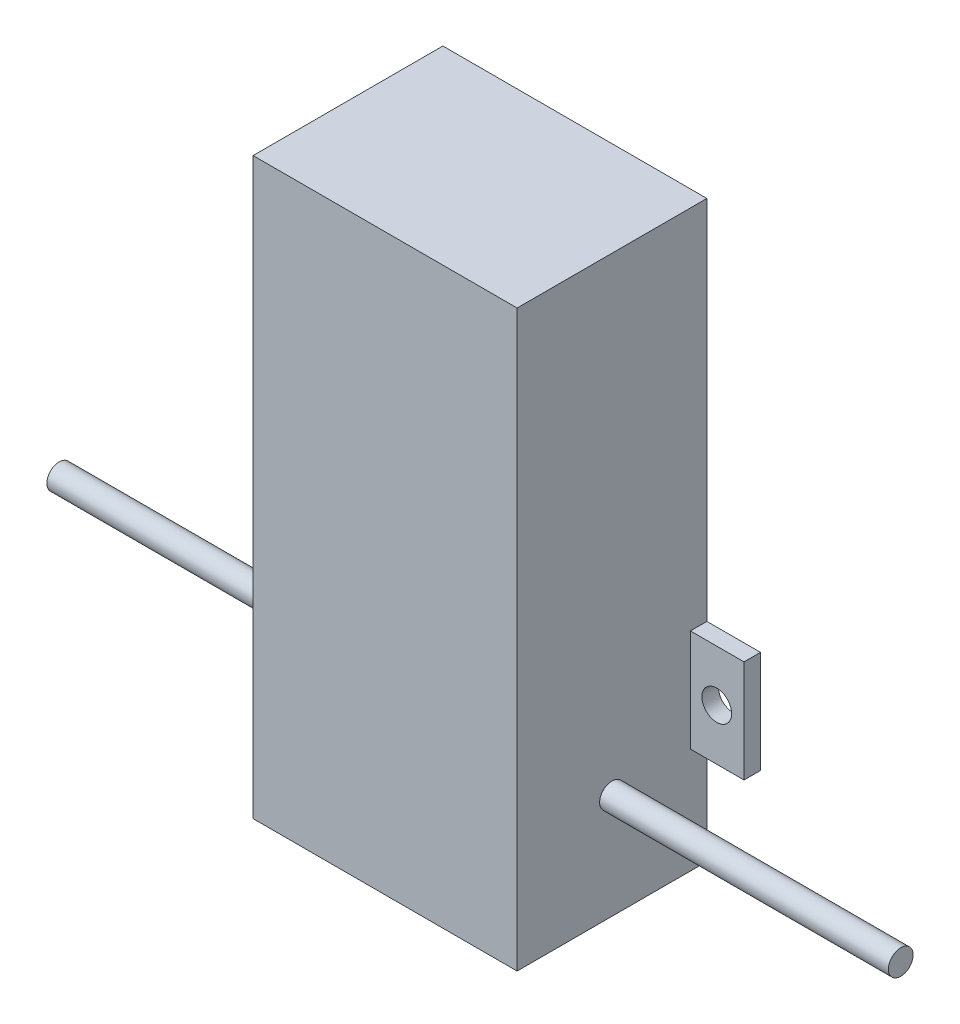
from build123d import *

# Parameters (mm, degrees)
SKETCH_1_W            = 32
SKETCH_1_H            = 69.6
EXTRUDE_1_DEPTH       = 23
SKETCH_2_R            = 1.5
EXTRUDE_2_DEPTH       = 35
SKETCH_3_W            = 2
SKETCH_3_H            = 3.6
EXTRUDE_3_DEPTH       = 4.5
SKETCH_5_W            = 16
SKETCH_5_H            = 23
CUT_EXTRUDE_1_DEPTH   = 71.5
SKETCH_6_W            = 4.5
SKETCH_6_H            = 3.6
CUT_EXTRUDE_2_DEPTH   = 1
SKETCH_7_W            = 2
SKETCH_7_H            = 4.4
EXTRUDE_4_DEPTH       = 6.5
SKETCH_9_W            = 1
SKETCH_9_H            = 1.8
CUT_EXTRUDE_3_DEPTH   = 4.5
MIRROR_4_OUTLINE_W    = 4.5
MIRROR_4_OUTLINE_H    = 1.8
MIRROR_4_DEPTH        = 1
MIRROR_4_2_OUTLINE_W  = 6.5
MIRROR_4_2_OUTLINE_H  = 4.4
MIRROR_4_2_DEPTH      = 2
SKETCH_10_W           = 1.5
SKETCH_10_H           = 2
EXTRUDE_5_DEPTH       = 4.5
MIRROR_START          = 34.279062003
MIRROR_25_OUTLINE_W   = 69.6
MIRROR_25_OUTLINE_H   = 23
MIRROR_25_DEPTH       = 16
MIRROR_START_2        = -0.720937997
MIRROR_25_2_OUTLINE_R = 1.5
MIRROR_25_2_DEPTH     = 35
MIRROR_START_3        = 27.779062003
MIRROR_25_3_OUTLINE_W = 4.4
MIRROR_25_3_OUTLINE_H = 2
MIRROR_25_3_DEPTH     = 6.5
MIRROR_25_4_OUTLINE_W = 4.5
MIRROR_25_4_OUTLINE_H = 2
MIRROR_25_4_DEPTH     = 1.5
SKETCH_12_W           = 2
SKETCH_12_H           = 4.395113111
EXTRUDE_6_DEPTH       = 7.5
SKETCH_15_W           = 2
SKETCH_15_H           = 3.6
EXTRUDE_7_DEPTH       = 6
SKETCH_14_R           = 1.801767182
CUT_EXTRUDE_4_DEPTH   = 6
SKETCH_17_W           = 2
SKETCH_17_H           = 4.5
EXTRUDE_8_DEPTH       = 6
SKETCH_16_R           = 1.798109405
CUT_EXTRUDE_5_DEPTH   = 6


# Read off the part's stored shape, not the designer's step: ﾐﾗｰ4, ﾐﾗｰ25
with BuildPart() as part:
    # ｽｹｯﾁ1 → ﾎﾞｽ - 押し出し1 (new body)
    with BuildSketch(Plane.XY):
        with Locations((50.279062003, -5.527058824)):
            Rectangle(SKETCH_1_W, SKETCH_1_H)
    extrude(amount=EXTRUDE_1_DEPTH)

    # ｽｹｯﾁ2 → ﾎﾞｽ - 押し出し2 (add)
    with BuildSketch(Plane(origin=(66.279062003, 0, 0), x_dir=(0, 0, -1), z_dir=(1, 0, 0))):
        with Locations(Location((-11.5, -27.627058824, 0), (0, 0, 180))):
            Circle(SKETCH_2_R)
    extrude(amount=EXTRUDE_2_DEPTH)

    # ｽｹｯﾁ3 → ﾎﾞｽ - 押し出し3 (add)
    with BuildSketch(Plane(origin=(66.279062003, 0, 0), x_dir=(0, 0, -1), z_dir=(1, 0, 0))):
        with Locations((-1, -21.322089651)):
            Rectangle(SKETCH_3_W, SKETCH_3_H)
    extrude(amount=EXTRUDE_3_DEPTH)

    # ｽｹｯﾁ5 → ｶｯﾄ - 押し出し1 (cut)
    with BuildSketch(Plane(origin=(0, 29.272941176, 0), x_dir=(1, 0, 0), z_dir=(0, 1, 0))):
        with Locations((42.279062003, -11.5)):
            Rectangle(SKETCH_5_W, SKETCH_5_H)
    extrude(amount=-CUT_EXTRUDE_1_DEPTH, mode=Mode.SUBTRACT)

    # ｽｹｯﾁ6 → ｶｯﾄ - 押し出し2 (cut)
    with BuildSketch(Plane.XY.offset(2)):
        with Locations((68.529062003, -21.322089651)):
            Rectangle(SKETCH_6_W, SKETCH_6_H)
    extrude(amount=-CUT_EXTRUDE_2_DEPTH, mode=Mode.SUBTRACT)

    # ｽｹｯﾁ7 → ﾎﾞｽ - 押し出し4 (add)
    with BuildSketch(Plane(origin=(66.279062003, 0, 0), x_dir=(0, 0, -1), z_dir=(1, 0, 0))):
        with Locations((-1, -17.322089651)):
            Rectangle(SKETCH_7_W, SKETCH_7_H)
    extrude(amount=EXTRUDE_4_DEPTH)

    # ｽｹｯﾁ9 → ｶｯﾄ - 押し出し3 (cut)
    with BuildSketch(Plane(origin=(70.779062003, 0, 0), x_dir=(0, 0, -1), z_dir=(1, 0, 0))):
        with Locations((-0.5, -22.222089651)):
            Rectangle(SKETCH_9_W, SKETCH_9_H)
    extrude(amount=-CUT_EXTRUDE_3_DEPTH, mode=Mode.SUBTRACT)

    # ﾐﾗｰ4 outline → ﾐﾗｰ4 (cut)
    with BuildSketch(Plane.XY):
        with Locations((68.529062003, -20.422089651)):
            Rectangle(MIRROR_4_OUTLINE_W, MIRROR_4_OUTLINE_H)
    extrude(amount=MIRROR_4_DEPTH, mode=Mode.SUBTRACT)

    # Mirror 4 2 outline → Mirror 4 2 (add)
    with BuildSketch(Plane.XY):
        with Locations((69.529062003, -25.322089651)):
            Rectangle(MIRROR_4_2_OUTLINE_W, MIRROR_4_2_OUTLINE_H)
    extrude(amount=MIRROR_4_2_DEPTH)

    # ｽｹｯﾁ10 → ﾎﾞｽ - 押し出し5 (add)
    with BuildSketch(Plane.XZ.offset(19.522089651)):
        with Locations((72.029062003, 1)):
            Rectangle(SKETCH_10_W, SKETCH_10_H)
    extrude(amount=EXTRUDE_5_DEPTH)

    # ﾐﾗｰ25 outline → ﾐﾗｰ25 (add)
    with BuildSketch(Plane.YZ.offset(MIRROR_START)):
        with Locations((-5.527058824, 11.5)):
            Rectangle(MIRROR_25_OUTLINE_W, MIRROR_25_OUTLINE_H)
    extrude(amount=MIRROR_25_DEPTH)

    # Mirror 25 2 outline → Mirror 25 2 (add)
    with BuildSketch(Plane.YZ.offset(MIRROR_START_2)):
        with Locations((-27.627058824, 11.5)):
            Circle(MIRROR_25_2_OUTLINE_R)
    extrude(amount=MIRROR_25_2_DEPTH)

    # Mirror 25 3 outline → Mirror 25 3 (add)
    with BuildSketch(Plane.YZ.offset(MIRROR_START_3)):
        with Locations((-17.322089651, 1)):
            Rectangle(MIRROR_25_3_OUTLINE_W, MIRROR_25_3_OUTLINE_H)
    extrude(amount=MIRROR_25_3_DEPTH)

    # Mirror 25 4 outline → Mirror 25 4 (add)
    with BuildSketch(Plane.YZ.offset(MIRROR_START_3)):
        with Locations((-21.772089651, 1)):
            Rectangle(MIRROR_25_4_OUTLINE_W, MIRROR_25_4_OUTLINE_H)
    extrude(amount=MIRROR_25_4_DEPTH)

    # ｽｹｯﾁ12 → ﾎﾞｽ - 押し出し6 (add)
    with BuildSketch(Plane.ZY.offset(-27.779062003)):
        with Locations((1, -26.219646207)):
            Rectangle(SKETCH_12_W, SKETCH_12_H)
    extrude(amount=-EXTRUDE_6_DEPTH)

    # ｽｹｯﾁ15 → ﾎﾞｽ - 押し出し7 (add)
    with BuildSketch(Plane(origin=(66.279062003, 0, 0), x_dir=(0, 0, -1), z_dir=(1, 0, 0))):
        with Locations((-1, -21.322089651)):
            Rectangle(SKETCH_15_W, SKETCH_15_H)
    extrude(amount=EXTRUDE_7_DEPTH)

    # ｽｹｯﾁ14 → ｶｯﾄ - 押し出し4 (cut)
    with BuildSketch(Plane.XY.offset(2)):
        with Locations((69.477294821, -21.322089651)):
            Circle(SKETCH_14_R)
    extrude(amount=-CUT_EXTRUDE_4_DEPTH, mode=Mode.SUBTRACT)

    # ｽｹｯﾁ17 → ﾎﾞｽ - 押し出し8 (add)
    with BuildSketch(Plane.ZY.offset(-34.279062003)):
        with Locations((1, -21.772089651)):
            Rectangle(SKETCH_17_W, SKETCH_17_H)
    extrude(amount=EXTRUDE_8_DEPTH)

    # ｽｹｯﾁ16 → ｶｯﾄ - 押し出し5 (cut)
    with BuildSketch(Plane.XY.offset(2)):
        with Locations((31.077171408, -21.772089651)):
            Circle(SKETCH_16_R)
    extrude(amount=-CUT_EXTRUDE_5_DEPTH, mode=Mode.SUBTRACT)


solid = part.part
